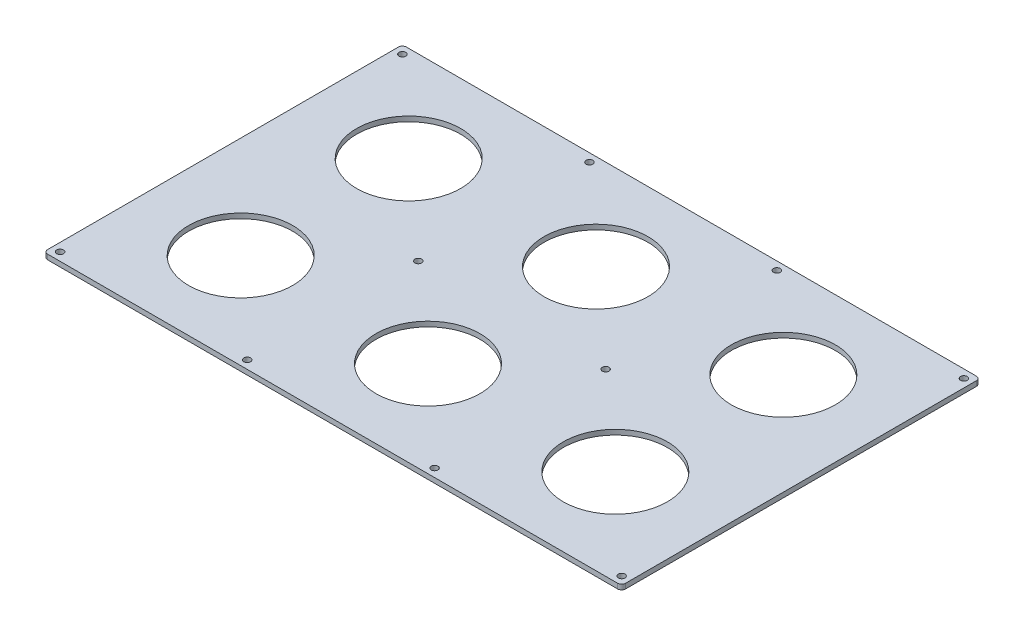
from build123d import *

# Parameters (mm, degrees)
SKETCH1_W             = 368.3
SKETCH1_H             = 228.6
SKETCH1_R             = 33.147
BOSS_EXTRUDE1_DEPTH   = 3.175
FILLET1_R             = 2.54
F_8_CLEARANCE_HOLE1_D = 4.3053


with BuildPart() as part:
    # Sketch1 → Boss-Extrude1 (new body)
    with BuildSketch(Plane(origin=(0, 0, 0), x_dir=(1, 0, 0), z_dir=(0, 1, 0))):
        Rectangle(SKETCH1_W, SKETCH1_H)
        with Locations((119.38, 53.5305)):
            Circle(SKETCH1_R, mode=Mode.SUBTRACT)
        with Locations((0, 53.5305)):
            Circle(SKETCH1_R, mode=Mode.SUBTRACT)
        with Locations((-119.38, 53.5305)):
            Circle(SKETCH1_R, mode=Mode.SUBTRACT)
        with Locations((-119.38, -53.5305)):
            Circle(SKETCH1_R, mode=Mode.SUBTRACT)
        with Locations((0, -53.5305)):
            Circle(SKETCH1_R, mode=Mode.SUBTRACT)
        with Locations((119.38, -53.5305)):
            Circle(SKETCH1_R, mode=Mode.SUBTRACT)
    extrude(amount=BOSS_EXTRUDE1_DEPTH)

    # Fillet1
    fillet1_edges = [part.edges().sort_by_distance(p)[0] for p in [
        (-184.15, 1.5875, 114.3),
        (184.15, 1.5875, 114.3),
        (184.15, 1.5875, -114.3),
        (-184.15, 1.5875, -114.3),
    ]]
    fillet(fillet1_edges, radius=FILLET1_R)

    # #8 Clearance Hole1 (through all)
    with Locations(Plane(origin=(0, 0, 0), x_dir=(-1, 0, 0), z_dir=(0, -1, 0))):
        with Locations((-178.907772673, 109.057772673), (-59.69, 109.057772673), (59.69, 109.057772673), (178.907772673, 109.057772673), (178.907772673, -109.057772673), (59.69, -109.057772673), (-59.69, -109.057772673), (-178.907772673, -109.057772673), (59.69, 0), (-59.69, 0)):
            Hole(F_8_CLEARANCE_HOLE1_D / 2)


solid = part.part
